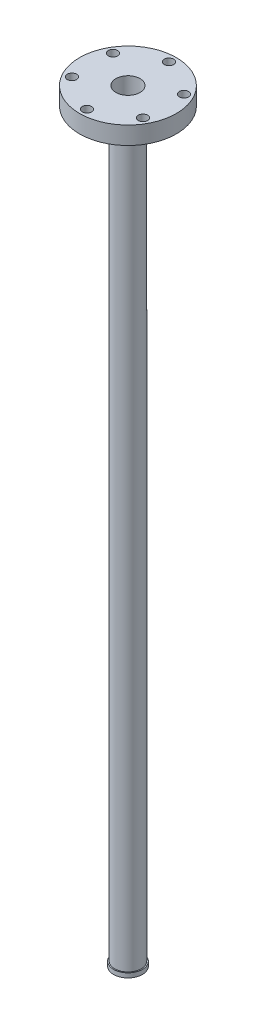
from build123d import *

# Parameters (mm, degrees)
SKETCH1_R         = 9.525
SKETCH1_R_2       = 8.636
EXTRUDE1_DEPTH    = 546.1
EXTRUDE2_START    = -12.7
SKETCH2_R         = 34.671
SKETCH2_R_2       = 8.636
EXTRUDE2_DEPTH    = 12.7
SKETCH3_R         = 3.3655
EXTRUDE3_DEPTH    = 549.296786861
CIRPATTERN1_COUNT = 6
SKETCH4_R         = 10.31875
SKETCH4_R_2       = 8.636
EXTRUDE4_DEPTH    = 3.175


with BuildPart() as part:
    # Sketch1 → Extrude1 (new body)
    with BuildSketch(Plane(origin=(0, 0, 0), x_dir=(1, 0, 0), z_dir=(0, 1, 0))):
        Circle(SKETCH1_R)
        Circle(SKETCH1_R_2, mode=Mode.SUBTRACT)
    extrude(amount=EXTRUDE1_DEPTH)

    # Sketch2 → Extrude2 (add)
    with BuildSketch(Plane(origin=(0, 546.1, 0), x_dir=(1, 0, 0), z_dir=(0, 1, 0)).offset(EXTRUDE2_START)):
        Circle(SKETCH2_R)
        Circle(SKETCH2_R_2, mode=Mode.SUBTRACT)
    extrude(amount=EXTRUDE2_DEPTH)

    # Sketch3 → Extrude3 (cut, through all)
    with BuildSketch(Plane(origin=(0, 546.1, 0), x_dir=(1, 0, 0), z_dir=(0, 1, 0))):
        with Locations((0, 29.3624)):
            Circle(SKETCH3_R)
    extrude3 = extrude(amount=-EXTRUDE3_DEPTH, mode=Mode.SUBTRACT)

    # CirPattern1: Extrude3 ×6 about axis
    cirpattern1_axis = Axis((0, 546.1, 0), (0, -1, 0))
    for i in range(1, CIRPATTERN1_COUNT):
        add(extrude3.rotate(cirpattern1_axis, i * 360 / CIRPATTERN1_COUNT), mode=Mode.SUBTRACT)

    # Sketch4 → Extrude4 (add)
    with BuildSketch(Plane.XZ):
        Circle(SKETCH4_R)
        Circle(SKETCH4_R_2, mode=Mode.SUBTRACT)
    extrude(amount=-EXTRUDE4_DEPTH)


solid = part.part
